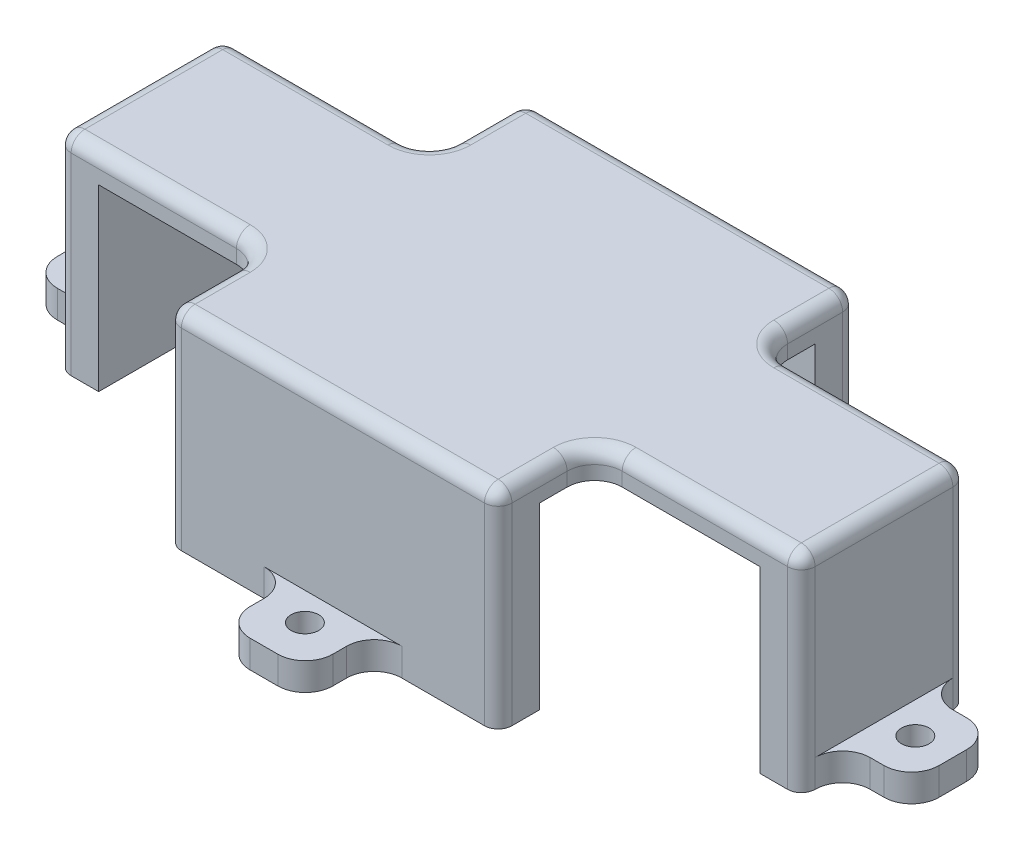
from build123d import *

# Parameters (mm, degrees)
SKETCH1_W           = 54
SKETCH1_H           = 26
SKETCH1_W_2         = 48
SKETCH1_H_2         = 20
BOSS_EXTRUDE1_DEPTH = 13
SKETCH2_W           = 54
SKETCH2_H           = 26
BOSS_EXTRUDE2_DEPTH = 2
SKETCH3_W           = 15
SKETCH3_H           = 7
CUT_EXTRUDE1_DEPTH  = 58.92236183
FILLET1_R           = 2
FILLET2_R           = 1
SKETCH4_R           = 1
BOSS_EXTRUDE3_DEPTH = 2
FILLET3_R           = 2


with BuildPart() as part:
    # Sketch1 → Boss-Extrude1 (new body)
    with BuildSketch(Plane(origin=(0, 0, 0), x_dir=(1, 0, 0), z_dir=(0, 1, 0))):
        with Locations((24, 10)):
            Rectangle(SKETCH1_W, SKETCH1_H)
        with Locations((24, 10)):
            Rectangle(SKETCH1_W_2, SKETCH1_H_2, mode=Mode.SUBTRACT)
    extrude(amount=BOSS_EXTRUDE1_DEPTH)

    # Sketch2 → Boss-Extrude2 (add)
    with BuildSketch(Plane(origin=(0, 13, 0), x_dir=(1, 0, 0), z_dir=(0, 1, 0))):
        with Locations((24, 10)):
            Rectangle(SKETCH2_W, SKETCH2_H)
    extrude(amount=BOSS_EXTRUDE2_DEPTH)

    # Sketch3 → Cut-Extrude1 (cut, through all)
    with BuildSketch(Plane(origin=(0, 15, 0), x_dir=(1, 0, 0), z_dir=(0, 1, 0))):
        with Locations((4.5, 19.5)):
            Rectangle(SKETCH3_W, SKETCH3_H)
        with Locations((4.5, 0.5)):
            Rectangle(SKETCH3_W, SKETCH3_H)
        with Locations((43.5, 0.5)):
            Rectangle(SKETCH3_W, SKETCH3_H)
        with Locations((43.5, 19.5)):
            Rectangle(SKETCH3_W, SKETCH3_H)
    extrude(amount=-CUT_EXTRUDE1_DEPTH, mode=Mode.SUBTRACT)

    # Fillet1
    fillet1_edges = [part.edges().sort_by_distance(p)[0] for p in [
        (12, 14, -16),
        (36, 14, -16),
        (36, 14, -4),
        (12, 14, -4),
    ]]
    fillet(fillet1_edges, radius=FILLET1_R)

    # Fillet2
    fillet2_edges = [part.edges().sort_by_distance(p)[0] for p in [
        (-3, 7.5, -16),
        (12, 7.5, -23),
        (3.5, 15, -16),
        (36, 15, 0.5),
        (3.5, 15, -4),
        (12, 15, -20.5),
        (44.5, 15, -16),
        (36.585786438, 15, -3.414213562),
        (11.414213562, 15, -3.414213562),
        (11.414213562, 15, -16.585786438),
        (36.585786438, 15, -16.585786438),
        (-3, 15, -10),
        (24, 15, 3),
        (51, 15, -10),
        (24, 15, -23),
        (51, 7.5, -16),
        (36, 7.5, -23),
        (36, 15, -20.5),
        (51, 7.5, -4),
        (36, 7.5, 3),
        (44.5, 15, -4),
        (-3, 7.5, -4),
        (12, 7.5, 3),
        (12, 15, 0.5),
    ]]
    fillet(fillet2_edges, radius=FILLET2_R)

    # Sketch4 → Boss-Extrude3 (add)
    # profile 1 of 4: a face of its own
    with BuildSketch(Plane.XZ):
        with BuildLine():
            Line((24, 3), (21, 3))
            Line((21, 3), (21, 6))
            ThreePointArc((21, 6), (21.585786438, 7.414213562), (23, 8))
            Line((23, 8), (25, 8))
            ThreePointArc((25, 8), (26.414213562, 7.414213562), (27, 6))
            Line((27, 6), (27, 3))
            Line((27, 3), (24, 3))
        make_face()
        with Locations(Location((24, 5.034061628, 0), (0, 0, 270))):
            Circle(SKETCH4_R, mode=Mode.SUBTRACT)
    # profile 2 of 4: a face of its own
    with BuildSketch(Plane.XZ):
        with BuildLine():
            Line((27, -23), (24, -23))
            Line((24, -23), (21, -23))
            Line((21, -23), (21, -26))
            ThreePointArc((21, -26), (21.585786438, -27.414213562), (23, -28))
            Line((23, -28), (25, -28))
            ThreePointArc((25, -28), (26.414213562, -27.414213562), (27, -26))
            Line((27, -26), (27, -23))
        make_face()
        with Locations(Location((24, -25.034061628, 0), (0, 0, 90))):
            Circle(SKETCH4_R, mode=Mode.SUBTRACT)
    # profile 3 of 4: a face of its own
    with BuildSketch(Plane.XZ):
        with BuildLine():
            Line((-3, -10), (-3, -7))
            Line((-3, -7), (-6, -7))
            ThreePointArc((-6, -7), (-7.414213562, -7.585786438), (-8, -9))
            Line((-8, -9), (-8, -11))
            ThreePointArc((-8, -11), (-7.414213562, -12.414213562), (-6, -13))
            Line((-6, -13), (-3, -13))
            Line((-3, -13), (-3, -10))
        make_face()
        with Locations(Location((-5.274023851, -10, 0), (0, 0, 270))):
            Circle(SKETCH4_R, mode=Mode.SUBTRACT)
    # profile 4 of 4: a face of its own
    with BuildSketch(Plane.XZ):
        with BuildLine():
            Line((51, -13), (51, -10))
            Line((51, -10), (51, -7))
            Line((51, -7), (54, -7))
            ThreePointArc((54, -7), (55.414213562, -7.585786438), (56, -9))
            Line((56, -9), (56, -11))
            ThreePointArc((56, -11), (55.414213562, -12.414213562), (54, -13))
            Line((54, -13), (51, -13))
        make_face()
        with Locations(Location((53.274023851, -10, 0), (0, 0, 90))):
            Circle(SKETCH4_R, mode=Mode.SUBTRACT)
    extrude(amount=-BOSS_EXTRUDE3_DEPTH)

    # Fillet3
    fillet3_edges = [part.edges().sort_by_distance(p)[0] for p in [
        (27, 1, 3),
        (21, 1, 3),
        (51, 1, -7),
        (51, 1, -13),
        (27, 1, -23),
        (21, 1, -23),
        (-3, 1, -13),
        (-3, 1, -7),
    ]]
    fillet(fillet3_edges, radius=FILLET3_R - 0.0001)  # a hair under: the kernel refuses the full size


solid = part.part
